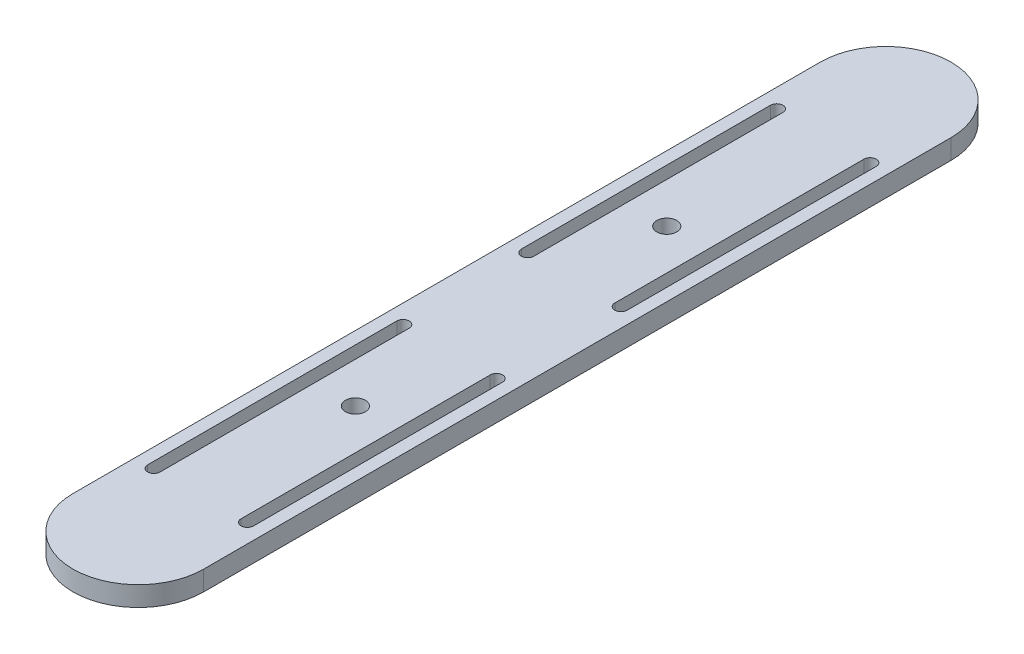
from build123d import *

# Parameters (mm, degrees)
BOSS_EXTRUDE1_DEPTH     = 3.175
CUT_EXTRUDE1_DEPTH      = 131.960225355
CUT_EXTRUDE1_DEPTH_BACK = 131.960225355
SKETCH2_R               = 1.6
CUT_EXTRUDE2_DEPTH      = 131.960225355
CUT_EXTRUDE2_DEPTH_BACK = 131.960225355


with BuildPart() as part:
    # Sketch1 → Boss-Extrude1 (new body)
    with BuildSketch(Plane(origin=(0, 0, 0), x_dir=(1, 0, 0), z_dir=(0, 1, 0))):
        with BuildLine():
            Line((-10.5, 0), (-10.5, -120))
            ThreePointArc((-10.5, -120), (0, -130.5), (10.5, -120))
            Line((10.5, -120), (10.5, 0))
            ThreePointArc((10.5, 0), (0, 10.5), (-10.5, 0))
        make_face()
    extrude(amount=BOSS_EXTRUDE1_DEPTH)

    # Sketch2 → Cut-Extrude1 (cut, two sides: drawn at the far end of the back side and taken through both)
    with BuildSketch(Plane(origin=(0, 3.175, 0), x_dir=(1, 0, 0), z_dir=(0, 1, 0)).offset(-CUT_EXTRUDE1_DEPTH_BACK)):
        with Locations((0, -35.15)):
            Circle(SKETCH2_R)
        with Locations((0, -85.15)):
            Circle(SKETCH2_R)
    extrude(amount=CUT_EXTRUDE1_DEPTH + CUT_EXTRUDE1_DEPTH_BACK, mode=Mode.SUBTRACT)

    # Sketch3 → Cut-Extrude2 (cut, two sides: drawn at the far end of the back side and taken through both)
    with BuildSketch(Plane.XZ.offset(-CUT_EXTRUDE2_DEPTH_BACK)):
        with BuildLine():
            Line((-8.5, 110), (-8.5, 70))
            ThreePointArc((-8.5, 70), (-7.5, 69), (-6.5, 70))
            Line((-6.5, 70), (-6.5, 110))
            ThreePointArc((-6.5, 110), (-7.5, 111), (-8.5, 110))
        make_face()
        with BuildLine():
            Line((6.5, 110), (6.5, 70))
            ThreePointArc((6.5, 70), (7.5, 69), (8.5, 70))
            Line((8.5, 70), (8.5, 110))
            ThreePointArc((8.5, 110), (7.5, 111), (6.5, 110))
        make_face()
        with BuildLine():
            Line((8.5, 10), (8.5, 50))
            ThreePointArc((8.5, 50), (7.5, 51), (6.5, 50))
            Line((6.5, 50), (6.5, 10))
            ThreePointArc((6.5, 10), (7.5, 9), (8.5, 10))
        make_face()
        with BuildLine():
            Line((-8.5, 50), (-8.5, 10))
            ThreePointArc((-8.5, 10), (-7.5, 9), (-6.5, 10))
            Line((-6.5, 10), (-6.5, 50))
            ThreePointArc((-6.5, 50), (-7.5, 51), (-8.5, 50))
        make_face()
    extrude(amount=CUT_EXTRUDE2_DEPTH + CUT_EXTRUDE2_DEPTH_BACK, mode=Mode.SUBTRACT)


solid = part.part
